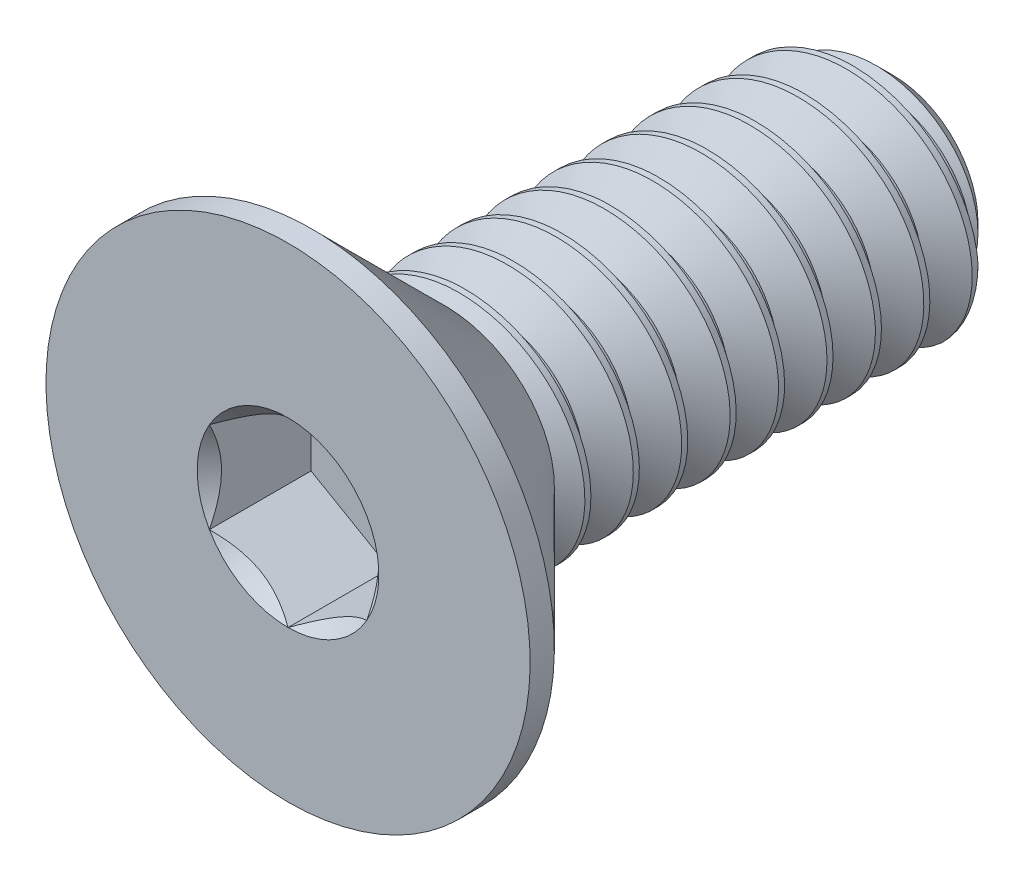
from build123d import *
from build123d.topology import SkipClean

# Parameters (mm, degrees)
SKETCH1_W          = 5
SKETCH1_H          = 1
CHAMFER1_SIZE      = 0.3
CUT_SWEEP1_PITCH   = 0.4
CUT_EXTRUDE2_DEPTH = 0.84


with BuildPart() as part:
    # Sketch1 → Revolve1 (revolve)
    with BuildSketch(Plane(origin=(0, 0, 0), x_dir=(0, 0, -1), z_dir=(1, 0, 0))):
        with Locations((2.5, 0.5)):
            Rectangle(SKETCH1_W, SKETCH1_H)
    revolve(axis=Axis((0, 0, -5), (0, 0, 1)))

    # Chamfer1
    chamfer1_edges = [part.edges().sort_by_distance(p)[0] for p in [
        (0, -1, -5),
    ]]
    chamfer(chamfer1_edges, length=CHAMFER1_SIZE)

    # Cut-Sweep1: the profile of Sketch2 profile screwed along a right-hand helix of 12.5 turns, 6 arcs to a turn; built about Z, then put on its axis
    with SkipClean():  # the faces are left unmerged after this step: merging them gives an invalid solid
        cut_sweep1_z = Axis((0, 0, 0), (0, 0, 1))
        cut_sweep1_corners = [(1.0006, 0, 0.00034641), (1.0006, 0, -0.35034641), (0.740192379, 0, -0.2), (0.740192379, 0, -0.15)]
        with BuildLine(mode=Mode.PRIVATE) as cut_sweep1_profile:
            Line(cut_sweep1_corners[0], cut_sweep1_corners[1])
            Line(cut_sweep1_corners[1], cut_sweep1_corners[2])
            Line(cut_sweep1_corners[2], cut_sweep1_corners[3])
            Line(cut_sweep1_corners[3], cut_sweep1_corners[0])
        cut_sweep1_cap = Face(cut_sweep1_profile.wire())
        cut_sweep1_turn_angles = [0, 30, 60, 90, 120, 150, 180, 210, 240, 270, 300, 330, 360]
        cut_sweep1_turn_weights = [1, 0.8660254037844387, 1, 0.8660254037844387, 1, 0.8660254037844387, 1, 0.8660254037844387, 1, 0.8660254037844387, 1, 0.8660254037844387, 1]
        cut_sweep1_turn_rails = [Edge.make_bspline([Vector(p[0], p[1], 0).rotate(cut_sweep1_z, cut_sweep1_turn_angles[k]) / cut_sweep1_turn_weights[k] + Vector(0, 0, p[2] + CUT_SWEEP1_PITCH * cut_sweep1_turn_angles[k] / 360) for k in range(13)], [0, 0, 0, 1, 1, 2, 2, 3, 3, 4, 4, 5, 5, 6, 6, 6], 2, cut_sweep1_turn_weights) for p in cut_sweep1_corners]
        cut_sweep1_turn_sides = [Face.make_surface_from_curves(cut_sweep1_turn_rails[p[0]], cut_sweep1_turn_rails[p[1]]) for p in [(0, 1), (1, 2), (2, 3), (3, 0)]]
        cut_sweep1_last_angles = [4320, 4350, 4380, 4410, 4440, 4470, 4500]
        cut_sweep1_last_weights = [1, 0.8660254037844387, 1, 0.8660254037844387, 1, 0.866025403784399, 1]
        cut_sweep1_last_rails = [Edge.make_bspline([Vector(p[0], p[1], 0).rotate(cut_sweep1_z, cut_sweep1_last_angles[k]) / cut_sweep1_last_weights[k] + Vector(0, 0, p[2] + CUT_SWEEP1_PITCH * cut_sweep1_last_angles[k] / 360) for k in range(7)], [0, 0, 0, 1, 1, 2, 2, 3, 3, 3], 2, cut_sweep1_last_weights) for p in cut_sweep1_corners]
        cut_sweep1_last_sides = [Face.make_surface_from_curves(cut_sweep1_last_rails[p[0]], cut_sweep1_last_rails[p[1]]) for p in [(0, 1), (1, 2), (2, 3), (3, 0)]]
        cut_sweep1 = Plane(origin=(0, 0, -5), x_dir=(0, 1, 0), z_dir=(0, 0, 1)) * Solid(Shell([*[p.moved(Location((0, 0, CUT_SWEEP1_PITCH * i))) for i in range(12) for p in cut_sweep1_turn_sides], *cut_sweep1_last_sides, cut_sweep1_cap, cut_sweep1_cap.rotate(cut_sweep1_z, 4500).moved(Location((0, 0, CUT_SWEEP1_PITCH * 4500 / 360)))]))
        add(cut_sweep1, mode=Mode.SUBTRACT)

    # Sketch7 → Revolve2 (revolve)
    with BuildSketch(Plane(origin=(0, 0, 0), x_dir=(0, 0, -1), z_dir=(1, 0, 0)), mode=Mode.PRIVATE) as revolve2_sk:
        Polygon((0, 2), (0.2, 2), (1.2, 1), (1.2, 0), (0, 0), align=None)
    revolve(revolve2_sk.sketch.rotate(Axis((0, 0, 0), (0, 0, -1)), 180), axis=Axis((0, 0, 0), (0, 0, -1)))

    # Boss-Extrude1 cone 1 section (through the dimple's axis) → Boss-Extrude1 (revolve)
    with SkipClean():  # the faces are left unmerged after this step: merging them gives an invalid solid
        with BuildSketch(Plane(origin=(0, 0, -1.2), x_dir=(0, -1, 0), z_dir=(1, 0, 0))):
            Polygon((0, 0), (1, 0), (0, 1), align=None)
        revolve(axis=Axis((0, 0, -1.2), (0, 0, -1)))

    # Sketch5 → Cut-Extrude2 (cut)
    with SkipClean():  # the faces are left unmerged after this step: merging them gives an invalid solid
        with BuildSketch(Plane.XY):
            Polygon((0.65, -0.375277675), (0.65, 0.375277675), (0, 0.75055535), (-0.65, 0.375277675), (-0.65, -0.375277675), (0, -0.75055535), align=None)
        extrude(amount=-CUT_EXTRUDE2_DEPTH, mode=Mode.SUBTRACT)

    # Cut-Extrude3 cone 1 section (through the dimple's axis) → Cut-Extrude3 (revolve, cut)
    with SkipClean():  # the faces are left unmerged after this step: merging them gives an invalid solid
        with BuildSketch(Plane(origin=(0, 0, 0), x_dir=(0, -1, 0), z_dir=(1, 0, 0))):
            Polygon((0, 0), (0.75055535, 0), (0, 0.75055535), align=None)
        revolve(axis=Axis((0, 0, 0), (0, 0, -1)), mode=Mode.SUBTRACT)


solid = part.part
